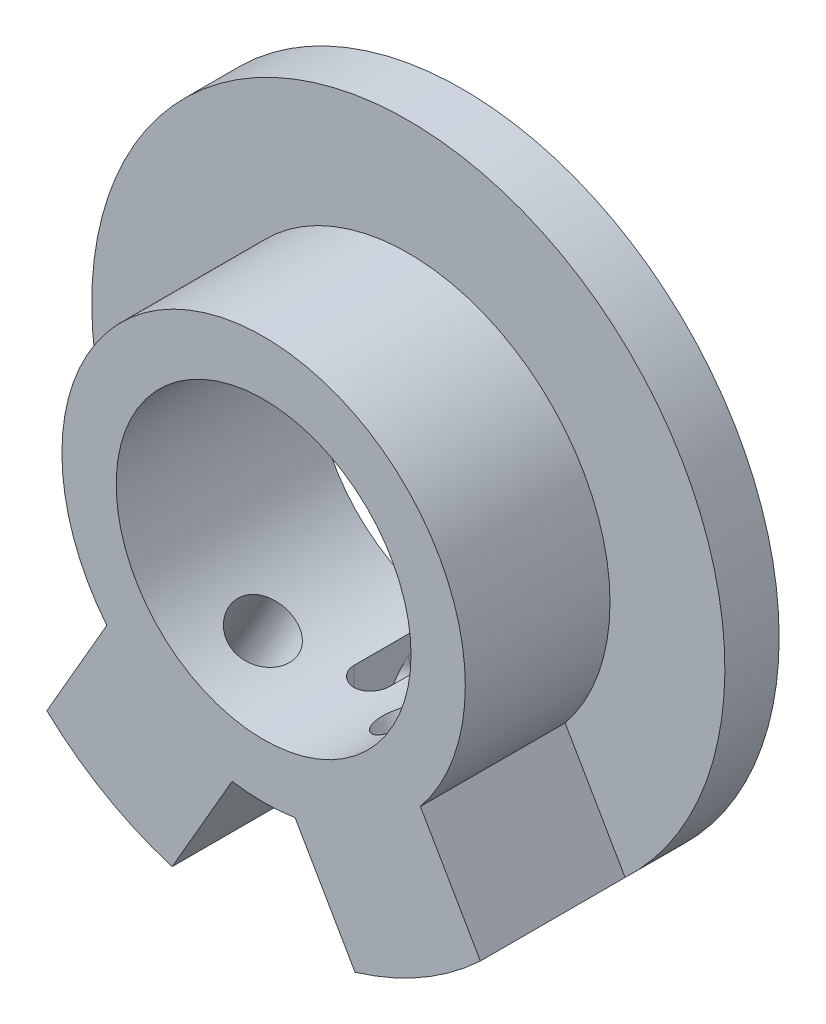
from build123d import *

# Parameters (mm, degrees)
SKETCH1_R                            = 17.5
SKETCH1_R_2                          = 8.15
BOSS_EXTRUDE1_DEPTH                  = 3
SKETCH2_R                            = 11.15
SKETCH2_R_2                          = 8.15
BOSS_EXTRUDE2_DEPTH                  = 8
BOSS_EXTRUDE5_REACH                  = 39.295
BOSS_EXTRUDE5_END_RADIUS             = 17.5
SKETCH4_W                            = 8
SKETCH4_H                            = 8
BOSS_EXTRUDE5_DIRECTION_2_REACH      = 39.295
BOSS_EXTRUDE5_DIRECTION_2_END_RADIUS = 11.15
CUT_EXTRUDE1_REACH                   = 39.295
CUT_EXTRUDE1_END_RADIUS              = 8.15
SKETCH3_R                            = 1.65
CUT_EXTRUDE1_DIRECTION_2_REACH       = 39.295
CUT_EXTRUDE1_DIRECTION_2_END_RADIUS  = 17.5
CUT_EXTRUDE2_DEPTH                   = 3
CUT_EXTRUDE2_DEPTH_BACK              = 27.009613773
SKETCH6_W                            = 2
SKETCH6_H                            = 9.382987565
CUT_EXTRUDE3_DEPTH                   = 3
FILLET2_R                            = 1


with BuildPart() as part:
    # Sketch1 → Boss-Extrude1 (new body)
    with BuildSketch(Plane.XY):
        Circle(SKETCH1_R)
        Circle(SKETCH1_R_2, mode=Mode.SUBTRACT)
    extrude(amount=BOSS_EXTRUDE1_DEPTH)

    # Sketch2 → Boss-Extrude2 (add)
    with BuildSketch(Plane.XY.offset(3)):
        Circle(SKETCH2_R)
        Circle(SKETCH2_R_2, mode=Mode.SUBTRACT)
    extrude(amount=BOSS_EXTRUDE2_DEPTH)

    # Boss-Extrude5: up to this cylinder (the profile starts inside it)
    boss_extrude5_end = Plane(origin=(0, 0, 7), z_dir=(0, 0, -1)) * Cylinder(BOSS_EXTRUDE5_END_RADIUS, 114.59, mode=Mode.PRIVATE)
    # Sketch4 → Boss-Extrude5 (add, up to the surface)
    with BuildSketch(Plane(origin=(-5.575, -9.656183252, 0), x_dir=(0, 0, -1), z_dir=(-0.500000000000001, -0.866025403784438, 0)), mode=Mode.PRIVATE) as boss_extrude5_sk1:
        with Locations((-7, 0)):
            Rectangle(SKETCH4_W, SKETCH4_H)
    boss_extrude5_tool1 = extrude(boss_extrude5_sk1.sketch, amount=BOSS_EXTRUDE5_REACH, mode=Mode.PRIVATE) & boss_extrude5_end
    boss_extrude5 = boss_extrude5_tool1.solids().sort_by_distance((-5.575, -9.656183, 7))[0]
    add(boss_extrude5)

    # Boss-Extrude5 direction 2: up to this cylinder (the profile starts outside it)
    boss_extrude5_direction_2_end = Plane(origin=(0, 0, 7), z_dir=(0, 0, -1)) * Cylinder(BOSS_EXTRUDE5_DIRECTION_2_END_RADIUS, 101.89, mode=Mode.PRIVATE)
    # Sketch4 → Boss-Extrude5 direction 2 (add, up to the surface)
    with BuildSketch(Plane(origin=(-5.575, -9.656183252, 0), x_dir=(0, 0, -1), z_dir=(-0.500000000000001, -0.866025403784438, 0)), mode=Mode.PRIVATE) as boss_extrude5_direction_2_sk1:
        with Locations((-7, 0)):
            Rectangle(SKETCH4_W, SKETCH4_H)
    boss_extrude5_direction_2_tool1 = extrude(boss_extrude5_direction_2_sk1.sketch, amount=-BOSS_EXTRUDE5_DIRECTION_2_REACH, mode=Mode.PRIVATE) - boss_extrude5_direction_2_end
    boss_extrude5_direction_2 = boss_extrude5_direction_2_tool1.solids().sort_by_distance((-5.575, -9.656183, 7))[0] + boss_extrude5_direction_2_tool1.solids().sort_by_distance((-5.575, -9.656183, 7))[1]
    add(boss_extrude5_direction_2)
    boss_extrude5 = boss_extrude5 + boss_extrude5_direction_2  # both directions under the feature's name, for the pattern or mirror that repeats it

    # Cut-Extrude1: up to this cylinder (the profile starts outside it)
    cut_extrude1_end = Plane(origin=(0, 0, 7), z_dir=(0, 0, -1)) * Cylinder(CUT_EXTRUDE1_END_RADIUS, 95.89, mode=Mode.PRIVATE)
    # Sketch3 → Cut-Extrude1 (cut, up to the surface)
    with BuildSketch(Plane(origin=(-5.575, -9.656183252, 0), x_dir=(0, 0, -1), z_dir=(-0.500000000000001, -0.866025403784438, 0)), mode=Mode.PRIVATE) as cut_extrude1_sk1:
        with Locations(Location((-7, 0, 0), (0, 0, 90))):
            Circle(SKETCH3_R)
    cut_extrude1_tool1 = extrude(cut_extrude1_sk1.sketch, amount=-CUT_EXTRUDE1_REACH, mode=Mode.PRIVATE) - cut_extrude1_end
    cut_extrude1 = cut_extrude1_tool1.solids().sort_by_distance((-5.575, -9.656183, 7))[0]
    add(cut_extrude1, mode=Mode.SUBTRACT)

    # Cut-Extrude1 direction 2: up to this cylinder (the profile starts inside it)
    cut_extrude1_direction_2_end = Plane(origin=(0, 0, 7), z_dir=(0, 0, -1)) * Cylinder(CUT_EXTRUDE1_DIRECTION_2_END_RADIUS, 114.59, mode=Mode.PRIVATE)
    # Sketch3 → Cut-Extrude1 direction 2 (cut, up to the surface)
    with BuildSketch(Plane(origin=(-5.575, -9.656183252, 0), x_dir=(0, 0, -1), z_dir=(-0.500000000000001, -0.866025403784438, 0)), mode=Mode.PRIVATE) as cut_extrude1_direction_2_sk1:
        with Locations(Location((-7, 0, 0), (0, 0, 90))):
            Circle(SKETCH3_R)
    cut_extrude1_direction_2_tool1 = extrude(cut_extrude1_direction_2_sk1.sketch, amount=CUT_EXTRUDE1_DIRECTION_2_REACH, mode=Mode.PRIVATE) & cut_extrude1_direction_2_end
    cut_extrude1_direction_2 = cut_extrude1_direction_2_tool1.solids().sort_by_distance((-5.575, -9.656183, 7))[0]
    add(cut_extrude1_direction_2, mode=Mode.SUBTRACT)
    cut_extrude1 = cut_extrude1 + cut_extrude1_direction_2  # both directions under the feature's name, for the pattern or mirror that repeats it

    # Mirror1: Boss-Extrude5, Cut-Extrude1 across plane
    add(boss_extrude5.mirror(Plane(origin=(0, 0, 0), x_dir=(0, 0, 1), z_dir=(1, 0, 0))))
    add(cut_extrude1.mirror(Plane(origin=(0, 0, 0), x_dir=(0, 0, 1), z_dir=(1, 0, 0))), mode=Mode.SUBTRACT)

    # Sketch5 → Cut-Extrude2 (cut, two sides: drawn at the far end of the back side and taken through both)
    with BuildSketch(Plane.XY.offset(3).offset(-CUT_EXTRUDE2_DEPTH_BACK)):
        with BuildLine():
            Line((-1, -9.088417645), (-1, -8.088417645))
            Line((-1, -8.088417645), (1, -8.088417645))
            Line((1, -8.088417645), (1, -9.088417645))
            ThreePointArc((1, -9.088417645), (0, -10.088417645), (-1, -9.088417645))
        make_face()
    extrude(amount=CUT_EXTRUDE2_DEPTH + CUT_EXTRUDE2_DEPTH_BACK, mode=Mode.SUBTRACT)

    # Sketch6 → Cut-Extrude3 (cut)
    with BuildSketch(Plane.XY.offset(3)):
        with Locations((0, -12.779911428)):
            Rectangle(SKETCH6_W, SKETCH6_H)
    extrude(amount=CUT_EXTRUDE3_DEPTH, mode=Mode.SUBTRACT)

    # Fillet2
    # the kernel refuses this fillet: 1 mm, written as the material it adds along each edge
    with BuildSketch(Plane(origin=(1, -9.088417645, 6), x_dir=(0, 0, -1), z_dir=(0, -1, 0))) as fillet2_piece_1_section:
        with BuildLine():
            CenterArc((FILLET2_R, -FILLET2_R), FILLET2_R, 90, 90)
            Line((0, -FILLET2_R), (0, 0))
            Line((0, 0), (FILLET2_R, 0))
        make_face()
    fillet2_piece_1 = extrude(amount=4.516648766, mode=Mode.PRIVATE)
    fillet2_piece_1 = fillet2_piece_1 & Plane(origin=(0, 0, 5.777290132), x_dir=(1, 0, 0), z_dir=(0, 0, -1)) * Cylinder(11.15, 14, mode=Mode.PRIVATE)
    add(fillet2_piece_1)
    with BuildSketch(Plane(origin=(-1, -13.605066411, 6), x_dir=(1, 0, 0), z_dir=(0, 1, 0))) as fillet2_piece_2_section:
        with BuildLine():
            CenterArc((FILLET2_R, FILLET2_R), FILLET2_R, 180, 90)
            Line((0, FILLET2_R), (0, 0))
            Line((0, 0), (FILLET2_R, 0))
        make_face()
    fillet2_piece_2 = extrude(amount=4.516648766, mode=Mode.PRIVATE)
    fillet2_piece_2 = fillet2_piece_2 & Plane(origin=(0, 0, 5.777290055), x_dir=(1, 0, 0), z_dir=(0, 0, -1)) * Cylinder(11.15, 14, mode=Mode.PRIVATE)
    add(fillet2_piece_2)
    with BuildSketch(Plane(origin=(-1, -9.088417645, 6), x_dir=(1, 0, 0), z_dir=(0, 1, 0))) as fillet2_piece_3_section:
        with BuildLine():
            CenterArc((FILLET2_R, FILLET2_R), FILLET2_R, 180, 90)
            Line((0, FILLET2_R), (0, 0))
            Line((0, 0), (FILLET2_R, 0))
        make_face()
    fillet2_piece_3 = extrude(amount=3.5, mode=Mode.PRIVATE)
    fillet2_piece_3 = fillet2_piece_3 - Plane(origin=(0, 0, 5.774756303), x_dir=(1, 0, 0), z_dir=(0, 0, -1)) * Cylinder(8.15, 12, mode=Mode.PRIVATE)
    add(fillet2_piece_3)
    with BuildSketch(Plane(origin=(1, -5.588417645, 6), x_dir=(0, 0, -1), z_dir=(0, -1, 0))) as fillet2_piece_4_section:
        with BuildLine():
            CenterArc((FILLET2_R, -FILLET2_R), FILLET2_R, 90, 90)
            Line((0, -FILLET2_R), (0, 0))
            Line((0, 0), (FILLET2_R, 0))
        make_face()
    fillet2_piece_4 = extrude(amount=3.5, mode=Mode.PRIVATE)
    fillet2_piece_4 = fillet2_piece_4 - Plane(origin=(0, 0, 5.77475637), x_dir=(1, 0, 0), z_dir=(0, 0, -1)) * Cylinder(8.15, 12, mode=Mode.PRIVATE)
    add(fillet2_piece_4)
    # the kernel refuses this fillet: 1 mm, written as the material it takes off along each edge
    with BuildSketch(Plane(origin=(0, -9.088417645, 3), x_dir=(0.003141587485879873, 0.9999950652018583, 0), z_dir=(-0.9999950652018583, 0.003141587485879873, 0))) as fillet2_2_piece_1_section:
        with BuildLine():
            CenterArc((1 + FILLET2_R, FILLET2_R), FILLET2_R, 180, 90)
            Line((1 + FILLET2_R, 0), (1, 0))
            Line((1, 0), (1, FILLET2_R))
        make_face()
    fillet2_2_piece_1 = revolve(axis=Axis((0, -9.088417645, 3), (0, 0, -1)), revolution_arc=359.64, mode=Mode.PRIVATE)
    fillet2_2_piece_1 = split(fillet2_2_piece_1, bisect_by=Plane(origin=(1, -10.091717807, 2.766201228), z_dir=(-1, 0, 0)), keep=Keep.TOP, mode=Mode.PRIVATE)
    fillet2_2_piece_1 = split(fillet2_2_piece_1, bisect_by=Plane(origin=(-1, -10.091717807, 2.766201228), z_dir=(1, 0, 0)), keep=Keep.TOP, mode=Mode.PRIVATE)
    add(fillet2_2_piece_1, mode=Mode.SUBTRACT)


solid = part.part
